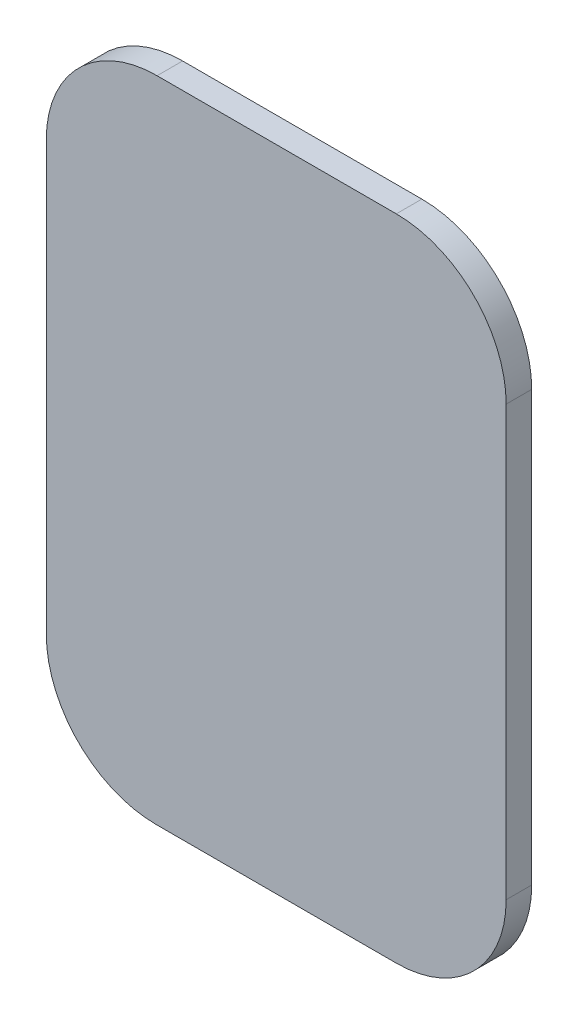
from build123d import *

# Parameters (mm, degrees)
LANDING_PAD_DEPTH = 0.1


with BuildPart() as part:
    # Sketch9 → landing-pad (new body)
    with BuildSketch(Plane.XY):
        with BuildLine():
            Line((0.900000047, 0.839998334), (0.900000047, -0.84))
            ThreePointArc((0.900000047, -0.84), (0.774055962, -1.144055916), (0.470000047, -1.27))
            Line((0.470000047, -1.27), (-0.469799953, -1.27))
            ThreePointArc((-0.469799953, -1.27), (-0.773997324, -1.143997324), (-0.9, -0.839799953))
            Line((-0.9, -0.839799953), (-0.9, 0.8364))
            ThreePointArc((-0.9, 0.8364), (-0.772997565, 1.143011001), (-0.466386564, 1.270013436))
            Line((-0.466386564, 1.270013436), (0.469984944, 1.270013436))
            ThreePointArc((0.469984944, 1.270013436), (0.774051539, 1.144064928), (0.900000047, 0.839998334))
        make_face()
    extrude(amount=-LANDING_PAD_DEPTH)


solid = part.part
